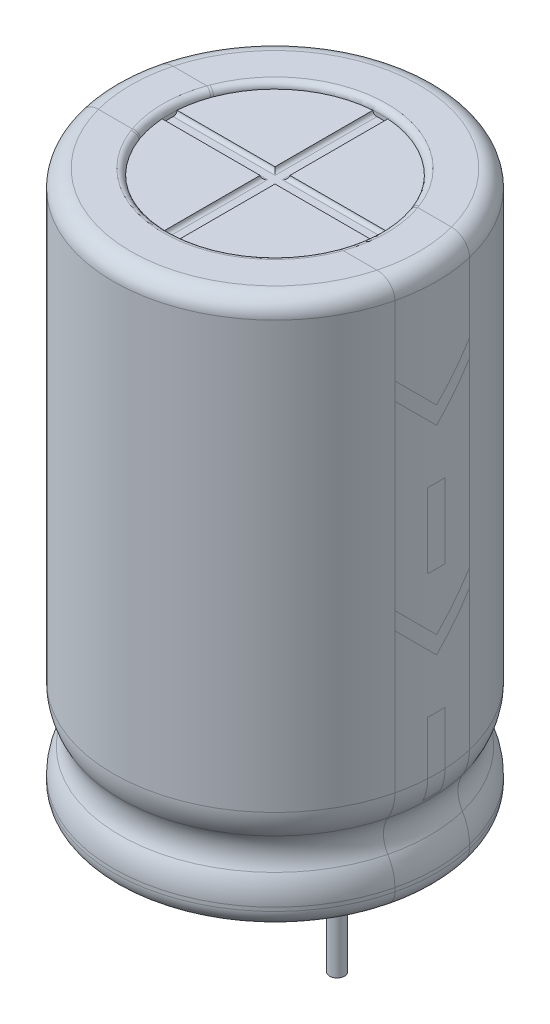
from build123d import *

# Parameters (mm, degrees)
SKETCH_2_R          = 4.25
CUT_EXTRUDE_1_DEPTH = 0.25
CUT_EXTRUDE_2_DEPTH = 0.15
FILLET_1_R          = 0.7
FILLET_2_R          = 2
CUT_EXTRUDE_START   = -0.25
SKETCH_4_R          = 4.25
CUT_EXTRUDE_3_DEPTH = 0.25
SKETCH_5_R          = 0.3
EXTRUDE_1_DEPTH     = 5
FILLET_3_R          = 0.15
FILLET_4_R          = 0.25
FILLET_5_R          = 0.25


with BuildPart() as part:
    # Эскиз1 → Повернуть2 (revolve)
    with BuildSketch(Plane.XY, mode=Mode.PRIVATE) as revolve_2_sk:
        with BuildLine():
            Line((0, 0), (-6.5, 0))
            Line((-6.5, 0), (-6.5, 1.539531364))
            ThreePointArc((-6.5, 1.539531364), (-6.05, 2.5), (-6.5, 3.460468636))
            Line((-6.5, 3.460468636), (-6.5, 22))
            Line((-6.5, 22), (0, 22))
            Line((0, 22), (0, 0))
        make_face()
    revolve(revolve_2_sk.sketch.rotate(Axis((0, 47.03836845, 0), (0, -1, 0)), 270), axis=Axis((0, 47.03836845, 0), (0, -1, 0)))

    # Эскиз2 → Вырез-Вытянуть1 (cut)
    with BuildSketch(Plane(origin=(0, 22, 0), x_dir=(1, 0, 0), z_dir=(0, 1, 0))):
        with Locations(Location((0, 0, 0), (0, 0, 270))):
            Circle(SKETCH_2_R)
    extrude(amount=-CUT_EXTRUDE_1_DEPTH, mode=Mode.SUBTRACT)

    # Эскиз3 → Вырез-Вытянуть2 (cut)
    with BuildSketch(Plane(origin=(0, 21.75, 0), x_dir=(1, 0, 0), z_dir=(0, 1, 0))):
        with BuildLine():
            Line((-0.3, 4.239398542), (-0.3, 0.3))
            Line((-0.3, 0.3), (-4.239398542, 0.3))
            ThreePointArc((-4.239398542, 0.3), (-4.25, 0), (-4.239398542, -0.3))
            Line((-4.239398542, -0.3), (-0.3, -0.3))
            Line((-0.3, -0.3), (-0.3, -4.239398542))
            ThreePointArc((-0.3, -4.239398542), (0, -4.25), (0.3, -4.239398542))
            Line((0.3, -4.239398542), (0.3, -0.3))
            Line((0.3, -0.3), (4.239398542, -0.3))
            ThreePointArc((4.239398542, -0.3), (4.25, 0), (4.239398542, 0.3))
            Line((4.239398542, 0.3), (0.3, 0.3))
            Line((0.3, 0.3), (0.3, 4.239398542))
            ThreePointArc((0.3, 4.239398542), (0, 4.25), (-0.3, 4.239398542))
        make_face()
    extrude(amount=-CUT_EXTRUDE_2_DEPTH, mode=Mode.SUBTRACT)

    # Скругление1
    fillet_1_edges = [part.edges().sort_by_distance(p)[0] for p in [
        (0, 0, -6.5),
        (0, 22, -6.5),
    ]]
    fillet(fillet_1_edges, radius=FILLET_1_R)

    # Скругление2
    fillet_2_edges = [part.edges().sort_by_distance(p)[0] for p in [
        (0, 1.539531364, -6.5),
        (0, 3.460468636, -6.5),
    ]]
    fillet(fillet_2_edges, radius=FILLET_2_R)

    # Эскиз4 → Вырез-Вытянуть3 (cut)
    with BuildSketch(Plane.XZ.offset(CUT_EXTRUDE_START)):
        with Locations(Location((0, 0, 0), (0, 0, 90))):
            Circle(SKETCH_4_R)
    extrude(amount=CUT_EXTRUDE_3_DEPTH, mode=Mode.SUBTRACT)

    # Эскиз5 → Бобышка-Вытянуть1 (add)
    with BuildSketch(Plane.XZ.offset(-0.25)):
        with Locations(Location((-2.5, 0, 0), (0, 0, 270))):
            Circle(SKETCH_5_R)
        with Locations(Location((2.5, 0, 0), (0, 0, 90))):
            Circle(SKETCH_5_R)
    extrude(amount=EXTRUDE_1_DEPTH)

    # Скругление3
    fillet_3_edges = [part.edges().sort_by_distance(p)[0] for p in [
        (0.3, 21.6, -2.269699271),
        (-2.269699271, 21.6, 0.3),
        (2.269699271, 21.6, 0.3),
        (0.3, 21.6, 2.269699271),
        (-0.3, 21.6, 2.269699271),
        (2.269699271, 21.6, -0.3),
        (-0.3, 21.6, -2.269699271),
        (-2.269699271, 21.6, -0.3),
    ]]
    fillet(fillet_3_edges, radius=FILLET_3_R - 0.0001)  # a hair under: the kernel refuses the full size

    # Скругление4
    fillet_4_edges = [part.edges().sort_by_distance(p)[0] for p in [
        (0, 22, -4.25),
    ]]
    fillet(fillet_4_edges, radius=FILLET_4_R - 0.0001)  # a hair under: the kernel refuses the full size

    # Скругление5
    fillet_5_edges = [part.edges().sort_by_distance(p)[0] for p in [
        (0, 0, -4.25),
    ]]
    fillet(fillet_5_edges, radius=FILLET_5_R - 0.0001)  # a hair under: the kernel refuses the full size


solid = part.part
